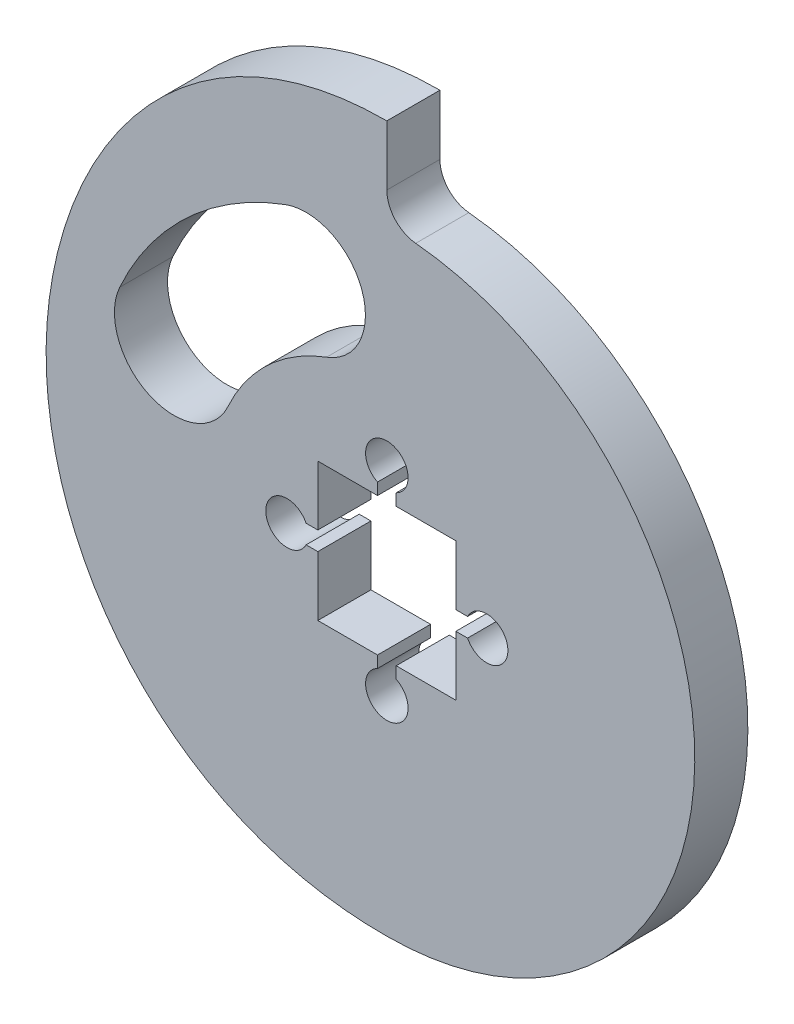
from build123d import *

# Parameters (mm, degrees)
BOSS_EXTRUDE1_DEPTH = 6.35
CUT_EXTRUDE1_DEPTH  = 64.001230115
FILLET2_R           = 3.81


with BuildPart() as part:
    # Sketch1 → Boss-Extrude1 (new body)
    with BuildSketch(Plane.XY):
        with BuildLine():
            Line((0, 36.83), (0, 47.625))
            add(Edge.make_bspline(
                [(0, 47.625), (-26.600153249, 47.625), (-56.149642057, -0.404637175), (-24.15519568, -36.984078787), (0, -36.83)],
                knots=[0, 0, 0, 0, 0.529165327, 1, 1, 1, 1], degree=3))
            ThreePointArc((0, -36.83), (36.83, 0), (0, 36.83))
        make_face()
        with BuildLine():
            Line((8.255, -8.255), (1.1176, -8.255))
            Line((1.1176, -8.255), (1.1176, -9.657085657))
            ThreePointArc((1.1176, -9.657085657), (0, -14.478), (-1.1176, -9.657085657))
            Line((-1.1176, -9.657085657), (-1.1176, -8.255))
            Line((-1.1176, -8.255), (-8.255, -8.255))
            Line((-8.255, -8.255), (-8.255, -1.1176))
            Line((-8.255, -1.1176), (-9.657085657, -1.1176))
            ThreePointArc((-9.657085657, -1.1176), (-14.478, 0), (-9.657085657, 1.1176))
            Line((-9.657085657, 1.1176), (-8.255, 1.1176))
            Line((-8.255, 1.1176), (-8.255, 8.255))
            Line((-8.255, 8.255), (-1.1176, 8.255))
            Line((-1.1176, 8.255), (-1.1176, 9.657085657))
            ThreePointArc((-1.1176, 9.657085657), (0, 14.478), (1.1176, 9.657085657))
            Line((1.1176, 9.657085657), (1.1176, 8.255))
            Line((1.1176, 8.255), (8.255, 8.255))
            Line((8.255, 8.255), (8.255, 1.1176))
            Line((8.255, 1.1176), (9.657085657, 1.1176))
            ThreePointArc((9.657085657, 1.1176), (14.478, 0), (9.657085657, -1.1176))
            Line((9.657085657, -1.1176), (8.255, -1.1176))
            Line((8.255, -1.1176), (8.255, -8.255))
        make_face(mode=Mode.SUBTRACT)
    extrude(amount=BOSS_EXTRUDE1_DEPTH)

    # Sketch5 → Cut-Extrude1 (cut, through all)
    with BuildSketch(Plane.XY.offset(6.35)):
        with BuildLine():
            ThreePointArc((-12.136378722, 32.883902073), (-23.899090909, 25.641297895), (-31.950108913, 14.416422734))
            ThreePointArc((-31.950108913, 14.416422734), (-28.392549398, 5.00872066), (-18.984847325, 8.566280175))
            ThreePointArc((-18.984847325, 8.566280175), (-14.200909091, 15.236133532), (-7.211471414, 19.539709927))
            ThreePointArc((-7.211471414, 19.539709927), (-3.001828995, 28.674259654), (-12.136378722, 32.883902073))
        make_face()
    extrude(amount=-CUT_EXTRUDE1_DEPTH, mode=Mode.SUBTRACT)

    # Fillet2
    fillet2_edges = [part.edges().sort_by_distance(p)[0] for p in [
        (0, 36.83, 3.175),
    ]]
    fillet(fillet2_edges, radius=FILLET2_R)


solid = part.part
